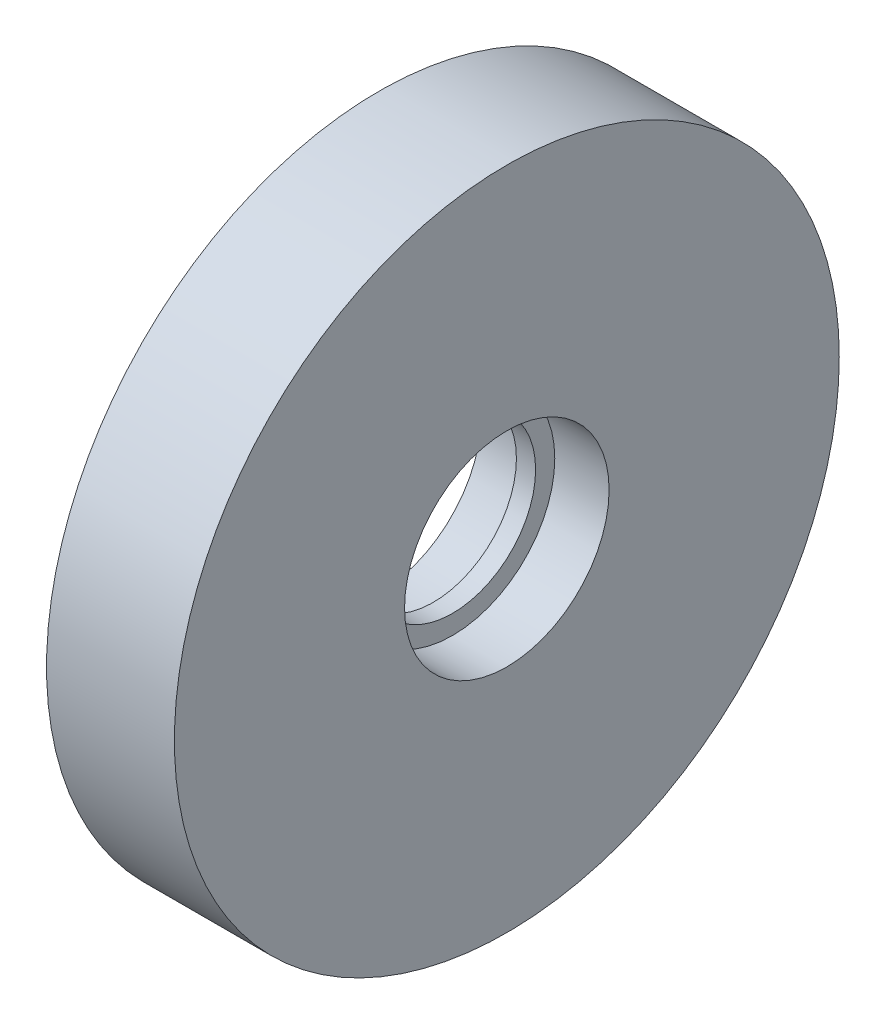
from build123d import *

# Parameters (mm, degrees)
SKETCH1_R           = 26
SKETCH1_R_2         = 8
BOSS_EXTRUDE1_DEPTH = 10
SKETCH2_R           = 8
SKETCH2_R_2         = 6.5
BOSS_EXTRUDE2_DEPTH = 0.75


with BuildPart() as part:
    # Sketch1 → Boss-Extrude1 (new body)
    with BuildSketch(Plane(origin=(0, 0, 0), x_dir=(0, 0, -1), z_dir=(1, 0, 0))):
        Circle(SKETCH1_R)
        Circle(SKETCH1_R_2, mode=Mode.SUBTRACT)
    extrude(amount=BOSS_EXTRUDE1_DEPTH)

    # Sketch2 → Boss-Extrude2 (add, symmetric)
    with BuildSketch(Plane(origin=(5, 0, 0), x_dir=(0, 0, -1), z_dir=(1, 0, 0))):
        Circle(SKETCH2_R)
        Circle(SKETCH2_R_2, mode=Mode.SUBTRACT)
    extrude(amount=BOSS_EXTRUDE2_DEPTH, both=True)


solid = part.part
